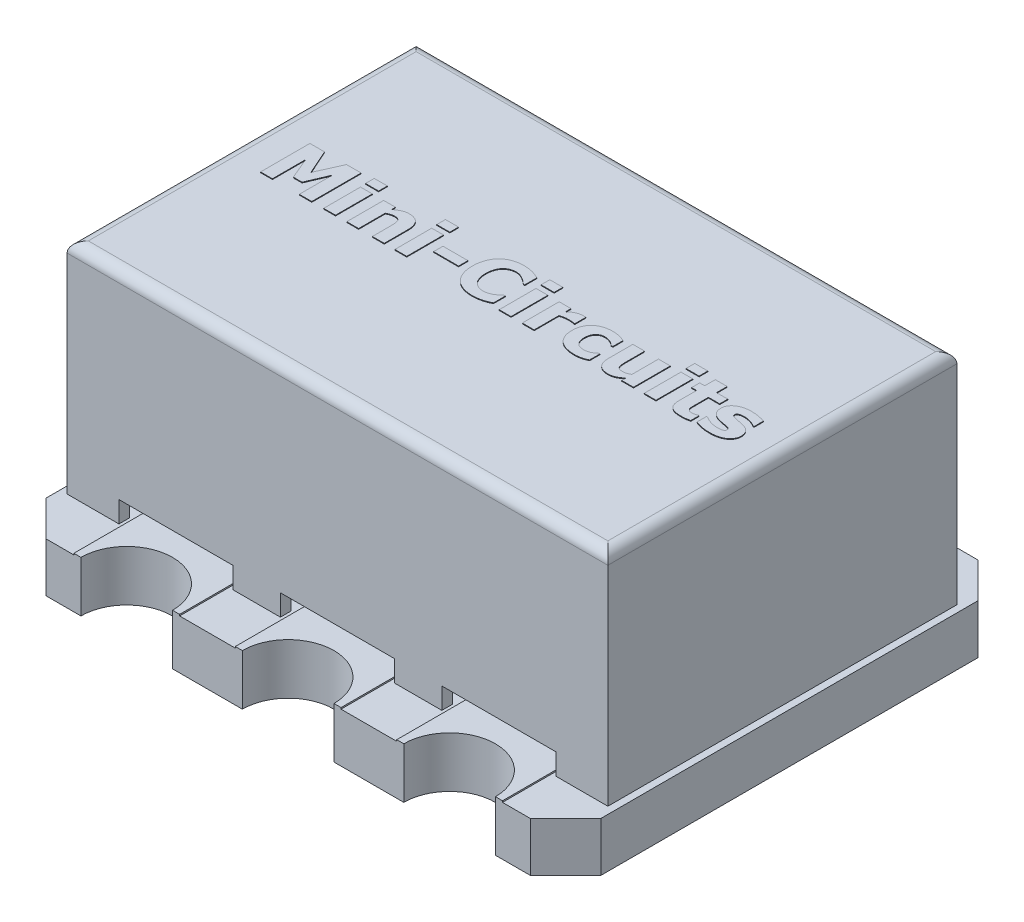
from build123d import *

# Parameters (mm, degrees)
BOSS_EXTRUDE1_DEPTH = 0.7
SKETCH2_W           = 7.67
SKETCH2_H           = 4.95
SKETCH2_W_2         = 7.37
SKETCH2_H_2         = 4.65
BOSS_EXTRUDE2_DEPTH = 3.11
SKETCH3_W           = 7.67
SKETCH3_H           = 4.95
BOSS_EXTRUDE3_DEPTH = 0.15
SKETCH4_W           = 1.62
SKETCH4_H           = 0.3
CUT_EXTRUDE1_DEPTH  = 8.869105731
FILLET1_R           = 0.15
BOSS_EXTRUDE4_DEPTH = 0.02
CHAMFER1_SIZE       = 0.5
WRAP1_OUTLINE_W     = 0.168354431
WRAP1_OUTLINE_H     = 0.522784811
WRAP1_OUTLINE_W_2   = 0.16835443
WRAP1_OUTLINE_W_3   = 0.186075949
WRAP1_OUTLINE_H_2   = 0.124050633
WRAP1_OUTLINE_W_4   = 0.18607595
WRAP1_OUTLINE_W_5   = 0.354430379
WRAP1_OUTLINE_H_3   = 0.132911393
WRAP1_DEPTH         = 0.01


# Read off the part's stored shape, not the designer's step: Wrap1
with BuildPart() as part:
    # Sketch1 → Boss-Extrude1 (new body)
    with BuildSketch(Plane(origin=(0, 0, 0), x_dir=(1, 0, 0), z_dir=(0, 1, 0))):
        with BuildLine():
            Line((-2.94, 3.175), (-3.935, 3.175))
            Line((-3.935, 3.175), (-3.935, -3.175))
            Line((-3.935, -3.175), (-2.94, -3.175))
            ThreePointArc((-2.94, -3.175), (-2.29, -2.525), (-1.64, -3.175))
            Line((-1.64, -3.175), (-0.65, -3.175))
            ThreePointArc((-0.65, -3.175), (0, -2.525), (0.65, -3.175))
            Line((0.65, -3.175), (1.64, -3.175))
            ThreePointArc((1.64, -3.175), (2.29, -2.525), (2.94, -3.175))
            Line((2.94, -3.175), (3.935, -3.175))
            Line((3.935, -3.175), (3.935, 3.175))
            Line((3.935, 3.175), (2.94, 3.175))
            ThreePointArc((2.94, 3.175), (2.29, 2.525), (1.64, 3.175))
            Line((1.64, 3.175), (0.65, 3.175))
            ThreePointArc((0.65, 3.175), (0, 2.525), (-0.65, 3.175))
            Line((-0.65, 3.175), (-1.64, 3.175))
            ThreePointArc((-1.64, 3.175), (-2.29, 2.525), (-2.94, 3.175))
        make_face()
    extrude(amount=BOSS_EXTRUDE1_DEPTH)

    # Sketch2 → Boss-Extrude2 (add)
    with BuildSketch(Plane(origin=(0, 0.7, 0), x_dir=(1, 0, 0), z_dir=(0, 1, 0))):
        Rectangle(SKETCH2_W, SKETCH2_H)
        Rectangle(SKETCH2_W_2, SKETCH2_H_2, mode=Mode.SUBTRACT)
    extrude(amount=BOSS_EXTRUDE2_DEPTH)

    # Sketch3 → Boss-Extrude3 (add)
    with BuildSketch(Plane(origin=(0, 3.81, 0), x_dir=(1, 0, 0), z_dir=(0, 1, 0))):
        Rectangle(SKETCH3_W, SKETCH3_H)
    extrude(amount=-BOSS_EXTRUDE3_DEPTH)

    # Sketch4 → Cut-Extrude1 (cut, through all)
    with BuildSketch(Plane.XY.offset(2.475)):
        with Locations((-2.29, 0.85)):
            Rectangle(SKETCH4_W, SKETCH4_H)
        with Locations((0, 0.85)):
            Rectangle(SKETCH4_W, SKETCH4_H)
        with Locations((2.29, 0.85)):
            Rectangle(SKETCH4_W, SKETCH4_H)
    extrude(amount=-CUT_EXTRUDE1_DEPTH, mode=Mode.SUBTRACT)

    # Fillet1
    fillet1_edges = [part.edges().sort_by_distance(p)[0] for p in [
        (-3.835, 3.81, 0),
        (0, 3.81, 2.475),
        (3.835, 3.81, 0),
        (0, 3.81, -2.475),
    ]]
    fillet(fillet1_edges, radius=FILLET1_R)

    # Sketch5 → Boss-Extrude4 (add)
    with BuildSketch(Plane(origin=(0, 0.7, 0), x_dir=(1, 0, 0), z_dir=(0, 1, 0))):
        with BuildLine():
            Line((-3.04, 3.175), (-3.04, -3.175))
            Line((-3.04, -3.175), (-2.94, -3.175))
            ThreePointArc((-2.94, -3.175), (-2.29, -2.525), (-1.64, -3.175))
            Line((-1.64, -3.175), (-1.54, -3.175))
            Line((-1.54, -3.175), (-1.54, 3.175))
            Line((-1.54, 3.175), (-1.64, 3.175))
            ThreePointArc((-1.64, 3.175), (-2.29, 2.525), (-2.94, 3.175))
            Line((-2.94, 3.175), (-3.04, 3.175))
        make_face()
        with BuildLine():
            Line((-0.65, 3.175), (-0.75, 3.175))
            Line((-0.75, 3.175), (-0.75, -3.175))
            Line((-0.75, -3.175), (-0.65, -3.175))
            ThreePointArc((-0.65, -3.175), (0, -2.525), (0.65, -3.175))
            Line((0.65, -3.175), (0.75, -3.175))
            Line((0.75, -3.175), (0.75, 3.175))
            Line((0.75, 3.175), (0.65, 3.175))
            ThreePointArc((0.65, 3.175), (0, 2.525), (-0.65, 3.175))
        make_face()
        with BuildLine():
            Line((1.54, 3.175), (1.54, -3.175))
            Line((1.54, -3.175), (1.64, -3.175))
            ThreePointArc((1.64, -3.175), (2.29, -2.525), (2.94, -3.175))
            Line((2.94, -3.175), (3.04, -3.175))
            Line((3.04, -3.175), (3.04, 3.175))
            Line((3.04, 3.175), (2.94, 3.175))
            ThreePointArc((2.94, 3.175), (2.29, 2.525), (1.64, 3.175))
            Line((1.64, 3.175), (1.54, 3.175))
        make_face()
    extrude(amount=BOSS_EXTRUDE4_DEPTH)

    # Chamfer1
    chamfer1_edges = [part.edges().sort_by_distance(p)[0] for p in [
        (-3.935, 0.35, 3.175),
        (-3.935, 0.35, -3.175),
        (3.935, 0.35, -3.175),
        (3.935, 0.35, 3.175),
    ]]
    chamfer(chamfer1_edges, length=CHAMFER1_SIZE)

    # Wrap1 outline → Wrap1 (add)
    with BuildSketch(Plane(origin=(0, 3.81, 0), x_dir=(1, 0, 0), z_dir=(0, 1, 0))):
        with BuildLine():
            add(Edge.make_bspline(
                [(-1.714556962, -0.002889473), (-1.714699231, 0.007823841), (-1.714982977, 0.029190727), (-1.717318036, 0.055488156), (-1.719653999, 0.07542269), (-1.72229176, 0.088275159), (-1.725303067, 0.09911351), (-1.728190187, 0.105313674), (-1.729509494, 0.108146919)],
                knots=[0, 0, 0, 0, 0.284872648, 0.568156771, 0.701834766, 0.818349265, 0.916992339, 1, 1, 1, 1], degree=3))
            Line((-1.714556962, -0.002889473), (-1.714556962, -0.265943271))
            Line((-1.714556962, -0.265943271), (-1.546202532, -0.265943271))
            Line((-1.546202532, -0.265943271), (-1.546202532, 0.076442014))
            add(Edge.make_bspline(
                [(-1.729232595, 0.274563059), (-1.722258695, 0.274385335), (-1.708644402, 0.274038388), (-1.688801077, 0.271870422), (-1.670101133, 0.268015771), (-1.652655209, 0.262430966), (-1.636256894, 0.255531674), (-1.621123197, 0.246911101), (-1.607179016, 0.236702025), (-1.594379031, 0.225075435), (-1.582967764, 0.211845728), (-1.573031363, 0.197031117), (-1.564831399, 0.180590017), (-1.557769576, 0.162760063), (-1.552629999, 0.143315669), (-1.548944842, 0.122380307), (-1.546491834, 0.099944031), (-1.546300895, 0.084432731), (-1.546202532, 0.076442014)],
                knots=[0, 0, 0, 0, 0.068027598, 0.132801972, 0.194426045, 0.253935589, 0.311211977, 0.367661586, 0.423395882, 0.479476329, 0.535968998, 0.593400846, 0.65299206, 0.714852443, 0.780154935, 0.848763899, 0.922090033, 1, 1, 1, 1], degree=3))
            add(Edge.make_bspline(
                [(-1.909493671, 0.20201559), (-1.902093009, 0.207660654), (-1.88768718, 0.218649107), (-1.865449913, 0.232882976), (-1.84395493, 0.245551971), (-1.822573278, 0.256136911), (-1.800701793, 0.264527111), (-1.777828377, 0.270236333), (-1.75391139, 0.274036971), (-1.73755468, 0.274385653), (-1.729232595, 0.274563059)],
                knots=[0, 0, 0, 0, 0.140758065, 0.273993942, 0.399134081, 0.518101627, 0.634549138, 0.752747963, 0.874201321, 1, 1, 1, 1], degree=3))
            Line((-1.909493671, 0.20201559), (-1.909493671, 0.25684154))
            Line((-1.909493671, 0.25684154), (-2.077848101, 0.25684154))
            Line((-2.077848101, 0.25684154), (-2.077848101, -0.265943271))
            Line((-2.077848101, -0.265943271), (-1.909493671, -0.265943271))
            Line((-1.909493671, -0.265943271), (-1.909493671, 0.109946761))
            add(Edge.make_bspline(
                [(-1.80911788, 0.141651666), (-1.817041108, 0.141255603), (-1.83321974, 0.140446873), (-1.853248777, 0.13545173), (-1.869536906, 0.129765651), (-1.882456253, 0.124345992), (-1.895871956, 0.117663616), (-1.904855925, 0.112574096), (-1.909493671, 0.109946761)],
                knots=[0, 0, 0, 0, 0.223069911, 0.455491904, 0.578023928, 0.709139627, 0.849850706, 1, 1, 1, 1], degree=3))
            add(Edge.make_bspline(
                [(-1.729509494, 0.108146919), (-1.731220493, 0.110933776), (-1.734575148, 0.116397802), (-1.741139855, 0.123481955), (-1.748816399, 0.129335452), (-1.757767464, 0.1339901), (-1.768160037, 0.137391388), (-1.780148757, 0.140098001), (-1.794050551, 0.141277922), (-1.803902129, 0.14152229), (-1.80911788, 0.141651666)],
                knots=[0, 0, 0, 0, 0.107518234, 0.210804643, 0.31600875, 0.42412717, 0.541431676, 0.67532446, 0.828106029, 1, 1, 1, 1], degree=3))
        make_face()
        with BuildLine():
            add(Edge.make_bspline(
                [(-0.543136867, -0.190903714), (-0.550767825, -0.182906354), (-0.566143722, -0.166792181), (-0.585786257, -0.13914485), (-0.602835267, -0.108818261), (-0.614776526, -0.081515483), (-0.622812381, -0.058329587), (-0.628037636, -0.040064708), (-0.632523654, -0.021130174), (-0.63601264, -0.001515741), (-0.639043447, 0.018734878), (-0.640842229, 0.039682606), (-0.642189997, 0.061287365), (-0.64233266, 0.075932078), (-0.642405063, 0.083364483)],
                knots=[0, 0, 0, 0, 0.110546357, 0.222743888, 0.338389091, 0.458388707, 0.520486429, 0.583949287, 0.648499339, 0.715196223, 0.783344706, 0.853408279, 0.925602568, 1, 1, 1, 1], degree=3))
            add(Edge.make_bspline(
                [(-0.28659019, -0.283664789), (-0.299292269, -0.283353898), (-0.324308154, -0.282741618), (-0.361111915, -0.278450813), (-0.396375521, -0.271036429), (-0.430111558, -0.261076176), (-0.46184072, -0.247911647), (-0.491407588, -0.23189156), (-0.518799408, -0.213127412), (-0.535037161, -0.198299943), (-0.543136867, -0.190903714)],
                knots=[0, 0, 0, 0, 0.136225063, 0.268286026, 0.39671569, 0.522303043, 0.645017192, 0.764394826, 0.882475572, 1, 1, 1, 1], degree=3))
            add(Edge.make_bspline(
                [(-0.140110759, -0.263174283), (-0.151113189, -0.266188201), (-0.172304041, -0.271993053), (-0.199182739, -0.277769909), (-0.221451132, -0.281106901), (-0.240705091, -0.282361162), (-0.262714346, -0.283636917), (-0.278326755, -0.283655143), (-0.28659019, -0.283664789)],
                knots=[0, 0, 0, 0, 0.23036849, 0.443693359, 0.554810457, 0.684770092, 0.833153096, 1, 1, 1, 1], degree=3))
            add(Edge.make_bspline(
                [(-0.039873418, -0.222747068), (-0.04841634, -0.226566433), (-0.065125693, -0.23403684), (-0.089726859, -0.245262717), (-0.114490641, -0.255335705), (-0.131482001, -0.26053428), (-0.140110759, -0.263174283)],
                knots=[0, 0, 0, 0, 0.259476127, 0.507516936, 0.749901271, 1, 1, 1, 1], degree=3))
            Line((-0.039873418, -0.222747068), (-0.039873418, -0.053285043))
            Line((-0.039873418, -0.053285043), (-0.058564082, -0.053285043))
            add(Edge.make_bspline(
                [(-0.133603639, -0.112126024), (-0.126145168, -0.107294928), (-0.111447768, -0.09777494), (-0.094383141, -0.084490826), (-0.081797819, -0.073852618), (-0.073207302, -0.066574115), (-0.065573762, -0.059756224), (-0.060820015, -0.05536767), (-0.058564082, -0.053285043)],
                knots=[0, 0, 0, 0, 0.279046371, 0.549878915, 0.678513651, 0.796762493, 0.903551864, 1, 1, 1, 1], degree=3))
            add(Edge.make_bspline(
                [(-0.257931171, -0.150753397), (-0.252479669, -0.150610313), (-0.241543353, -0.150323272), (-0.225208972, -0.14830069), (-0.208937091, -0.145174402), (-0.192922844, -0.14051913), (-0.177222731, -0.134927144), (-0.162111098, -0.128188752), (-0.147468119, -0.120787009), (-0.138224082, -0.115012363), (-0.133603639, -0.112126024)],
                knots=[0, 0, 0, 0, 0.123919129, 0.248595503, 0.373703788, 0.500242578, 0.627354259, 0.752317271, 0.87620086, 1, 1, 1, 1], degree=3))
            add(Edge.make_bspline(
                [(-0.391119462, -0.101465422), (-0.386320061, -0.105690923), (-0.376846659, -0.11403152), (-0.361142824, -0.124386413), (-0.344776158, -0.13310314), (-0.327555271, -0.139638482), (-0.310066645, -0.144598362), (-0.292544433, -0.147978152), (-0.275211747, -0.150392655), (-0.263661824, -0.150633766), (-0.257931171, -0.150753397)],
                knots=[0, 0, 0, 0, 0.13181231, 0.260180593, 0.387124392, 0.513753443, 0.639465987, 0.761800036, 0.881813824, 1, 1, 1, 1], degree=3))
            add(Edge.make_bspline(
                [(-0.456329114, 0.082810685), (-0.456169807, 0.071997937), (-0.455863823, 0.051229707), (-0.452075728, 0.021522844), (-0.446704605, -0.005579948), (-0.438365391, -0.029745549), (-0.428533134, -0.051312161), (-0.417412827, -0.070425135), (-0.405167672, -0.08726184), (-0.395716453, -0.096817589), (-0.391119462, -0.101465422)],
                knots=[0, 0, 0, 0, 0.16127913, 0.309771567, 0.446355257, 0.572913541, 0.690349552, 0.799629791, 0.902541663, 1, 1, 1, 1], degree=3))
            add(Edge.make_bspline(
                [(-0.394442247, 0.265840748), (-0.398942647, 0.260953043), (-0.408138893, 0.250965366), (-0.420075355, 0.23370113), (-0.430516182, 0.214177078), (-0.439888164, 0.192536109), (-0.447385539, 0.168479281), (-0.452502755, 0.142013731), (-0.455733424, 0.113210867), (-0.456125465, 0.093203636), (-0.456329114, 0.082810685)],
                knots=[0, 0, 0, 0, 0.100486144, 0.205336239, 0.316624156, 0.435234097, 0.561844987, 0.697210085, 0.842712832, 1, 1, 1, 1], degree=3))
            add(Edge.make_bspline(
                [(-0.258900316, 0.318866856), (-0.265135887, 0.318683846), (-0.277507029, 0.318320759), (-0.295875077, 0.316124367), (-0.313779586, 0.312172598), (-0.33127885, 0.306872466), (-0.348177515, 0.299581826), (-0.364461064, 0.290411109), (-0.380057133, 0.279152081), (-0.389592224, 0.27032874), (-0.394442247, 0.265840748)],
                knots=[0, 0, 0, 0, 0.125199765, 0.248391725, 0.370692055, 0.492894084, 0.614913344, 0.739370444, 0.867430816, 1, 1, 1, 1], degree=3))
            add(Edge.make_bspline(
                [(-0.138864715, 0.281485527), (-0.147723583, 0.286514142), (-0.165673932, 0.296703412), (-0.189707039, 0.306684387), (-0.209897948, 0.313013218), (-0.225721627, 0.316529369), (-0.242146914, 0.318434425), (-0.253265473, 0.318721412), (-0.258900316, 0.318866856)],
                knots=[0, 0, 0, 0, 0.239839301, 0.485976227, 0.611156554, 0.73804858, 0.86724402, 1, 1, 1, 1], degree=3))
            add(Edge.make_bspline(
                [(-0.060502373, 0.221398502), (-0.062849159, 0.223483122), (-0.067740841, 0.227828342), (-0.075614405, 0.234534541), (-0.084243231, 0.241838522), (-0.097324387, 0.25242004), (-0.115221256, 0.266276942), (-0.130798056, 0.276296672), (-0.138864715, 0.281485527)],
                knots=[0, 0, 0, 0, 0.095244834, 0.198530027, 0.313819432, 0.438262206, 0.709096368, 1, 1, 1, 1], degree=3))
            Line((-0.060502373, 0.221398502), (-0.039873418, 0.221398502))
            Line((-0.039873418, 0.221398502), (-0.039873418, 0.392937267))
            add(Edge.make_bspline(
                [(-0.141495253, 0.433779831), (-0.131476443, 0.430694019), (-0.112206909, 0.424758968), (-0.085384664, 0.413948707), (-0.061576019, 0.403318601), (-0.046782772, 0.396242324), (-0.039873418, 0.392937267)],
                knots=[0, 0, 0, 0, 0.286680941, 0.551383669, 0.790468623, 1, 1, 1, 1], degree=3))
            add(Edge.make_bspline(
                [(-0.286174842, 0.451778248), (-0.279020062, 0.45174304), (-0.265072658, 0.451674404), (-0.244669586, 0.450620554), (-0.225350935, 0.449218664), (-0.20146034, 0.446169613), (-0.173464419, 0.441756337), (-0.151893886, 0.436374355), (-0.141495253, 0.433779831)],
                knots=[0, 0, 0, 0, 0.146777353, 0.286125238, 0.419095851, 0.544057825, 0.780201286, 1, 1, 1, 1], degree=3))
            add(Edge.make_bspline(
                [(-0.545490506, 0.353340748), (-0.537629712, 0.360921562), (-0.521820404, 0.376167783), (-0.494733742, 0.395664227), (-0.465115068, 0.41266495), (-0.432844346, 0.426662325), (-0.398488443, 0.437840422), (-0.362458979, 0.446065039), (-0.324789348, 0.450784151), (-0.299202081, 0.451442873), (-0.286174842, 0.451778248)],
                knots=[0, 0, 0, 0, 0.114909661, 0.2311016, 0.35042709, 0.474070944, 0.600896219, 0.730500889, 0.862789974, 1, 1, 1, 1], degree=3))
            add(Edge.make_bspline(
                [(-0.642405063, 0.083364483), (-0.642137991, 0.097085377), (-0.64161478, 0.123965385), (-0.636773124, 0.163241394), (-0.629077325, 0.200548782), (-0.61828906, 0.235848833), (-0.604473575, 0.26897291), (-0.587769414, 0.299714315), (-0.568455423, 0.328195459), (-0.553131479, 0.344974314), (-0.545490506, 0.353340748)],
                knots=[0, 0, 0, 0, 0.139917816, 0.27410691, 0.403001204, 0.528090818, 0.650059438, 0.768450322, 0.884542466, 1, 1, 1, 1], degree=3))
        make_face()
        with BuildLine():
            add(Edge.make_bspline(
                [(0.778085443, 0.097347869), (0.776021143, 0.098082773), (0.771412548, 0.099723464), (0.763499151, 0.101378646), (0.753986415, 0.102924445), (0.743299966, 0.104029553), (0.732267042, 0.104978002), (0.721834686, 0.10566315), (0.712372143, 0.106116467), (0.70641526, 0.106179048), (0.703599684, 0.106208628)],
                knots=[0, 0, 0, 0, 0.087224477, 0.194730587, 0.321398094, 0.471261829, 0.622596227, 0.762651205, 0.887814869, 1, 1, 1, 1], degree=3))
            Line((0.778085443, 0.097347869), (0.793037975, 0.097347869))
            Line((0.793037975, 0.097347869), (0.793037975, 0.255041698))
            add(Edge.make_bspline(
                [(0.753164557, 0.25684154), (0.756349371, 0.25681355), (0.763090577, 0.256754305), (0.773334391, 0.256292923), (0.783447264, 0.255819279), (0.789993125, 0.255288564), (0.793037975, 0.255041698)],
                knots=[0, 0, 0, 0, 0.239309374, 0.506539313, 0.77046356, 1, 1, 1, 1], degree=3))
            add(Edge.make_bspline(
                [(0.580379747, 0.179725242), (0.584919482, 0.183591312), (0.593740106, 0.191103016), (0.607038967, 0.201433966), (0.619824387, 0.21083871), (0.632248461, 0.219006447), (0.644023075, 0.226542851), (0.655528065, 0.232665738), (0.666449918, 0.238060427), (0.680337664, 0.243447879), (0.697060799, 0.248584713), (0.716423352, 0.253504107), (0.735092495, 0.256156678), (0.747250476, 0.256617419), (0.753164557, 0.25684154)],
                knots=[0, 0, 0, 0, 0.092435416, 0.179600353, 0.261032412, 0.338425676, 0.410097306, 0.477650603, 0.540374375, 0.598835666, 0.708361082, 0.811442899, 0.908279025, 1, 1, 1, 1], degree=3))
            Line((0.580379747, 0.179725242), (0.580379747, 0.25684154))
            Line((0.580379747, 0.25684154), (0.412025316, 0.25684154))
            Line((0.412025316, 0.25684154), (0.412025316, -0.265943271))
            Line((0.412025316, -0.265943271), (0.580379747, -0.265943271))
            Line((0.580379747, -0.265943271), (0.580379747, 0.085579673))
            add(Edge.make_bspline(
                [(0.703599684, 0.106208628), (0.697737957, 0.106154938), (0.686377451, 0.106050881), (0.669880764, 0.105267473), (0.654457042, 0.103714903), (0.634865316, 0.1009349), (0.610064546, 0.095361186), (0.590573227, 0.088938552), (0.580379747, 0.085579673)],
                knots=[0, 0, 0, 0, 0.139991239, 0.271314476, 0.394253112, 0.510063494, 0.743775266, 1, 1, 1, 1], degree=3))
        make_face()
        with BuildLine():
            add(Edge.make_bspline(
                [(0.941871044, -0.216239948), (0.935209601, -0.210256117), (0.921912475, -0.198311595), (0.904639084, -0.17751779), (0.889812552, -0.154494979), (0.877126763, -0.129353408), (0.867103104, -0.101914211), (0.860155357, -0.07216495), (0.855762131, -0.040263643), (0.855300469, -0.018226212), (0.855063291, -0.006904505)],
                knots=[0, 0, 0, 0, 0.114542769, 0.228642609, 0.344856121, 0.464574641, 0.588522455, 0.717951557, 0.855097918, 1, 1, 1, 1], degree=3))
            add(Edge.make_bspline(
                [(1.164912975, -0.283664789), (1.153782158, -0.283512167), (1.13193415, -0.283212593), (1.099935136, -0.279873396), (1.069377575, -0.274852319), (1.04035821, -0.267696086), (1.012984408, -0.258312454), (0.987399759, -0.246622408), (0.963483056, -0.232852039), (0.949049617, -0.221757764), (0.941871044, -0.216239948)],
                knots=[0, 0, 0, 0, 0.140462675, 0.275705696, 0.405674832, 0.531147621, 0.652562158, 0.770400365, 0.885807008, 1, 1, 1, 1], degree=3))
            add(Edge.make_bspline(
                [(1.342405063, -0.242545327), (1.335787426, -0.245608123), (1.322550561, -0.251734449), (1.302147118, -0.259806503), (1.28119442, -0.266616659), (1.259835812, -0.272863083), (1.237648388, -0.27775045), (1.214426944, -0.281175058), (1.190057812, -0.283287231), (1.173408899, -0.28353722), (1.164912975, -0.283664789)],
                knots=[0, 0, 0, 0, 0.119003006, 0.238034614, 0.357845363, 0.478484315, 0.601114968, 0.72830586, 0.861354732, 1, 1, 1, 1], degree=3))
            Line((1.342405063, -0.242545327), (1.342405063, -0.09758884))
            Line((1.342405063, -0.09758884), (1.31900712, -0.09758884))
            add(Edge.make_bspline(
                [(1.269580696, -0.136077764), (1.27453919, -0.133083964), (1.284068803, -0.127330248), (1.296844633, -0.11738703), (1.308353509, -0.10754195), (1.315522245, -0.100844576), (1.31900712, -0.09758884)],
                knots=[0, 0, 0, 0, 0.276483243, 0.531366743, 0.772187384, 1, 1, 1, 1], degree=3))
            add(Edge.make_bspline(
                [(1.171973892, -0.159614157), (1.17705479, -0.159556593), (1.186959807, -0.159444374), (1.201368762, -0.157931908), (1.215046183, -0.155976623), (1.22788801, -0.152887686), (1.239817753, -0.149143498), (1.250777324, -0.145147713), (1.260665572, -0.140917755), (1.266694915, -0.137644445), (1.269580696, -0.136077764)],
                knots=[0, 0, 0, 0, 0.150109928, 0.292633611, 0.4278751, 0.558240399, 0.682503444, 0.797301157, 0.902983704, 1, 1, 1, 1], degree=3))
            add(Edge.make_bspline(
                [(1.032278481, -0.006904505), (1.032381902, -0.0129536), (1.032582844, -0.024706687), (1.034217444, -0.041797964), (1.037128681, -0.057767983), (1.041127417, -0.072645222), (1.046197854, -0.086407351), (1.052533673, -0.098989125), (1.059788169, -0.110586777), (1.068500075, -0.120825061), (1.078047261, -0.13003931), (1.088651502, -0.137992253), (1.100266177, -0.144629267), (1.11274144, -0.150260509), (1.126272726, -0.154309297), (1.140668481, -0.157366139), (1.155995367, -0.159386035), (1.166567844, -0.159536976), (1.171973892, -0.159614157)],
                knots=[0, 0, 0, 0, 0.076896037, 0.149405131, 0.217993584, 0.283037434, 0.345046743, 0.404084223, 0.461863406, 0.518505364, 0.574527063, 0.630265387, 0.686520102, 0.744305242, 0.803876747, 0.865671956, 0.931313748, 1, 1, 1, 1], degree=3))
            add(Edge.make_bspline(
                [(1.169204905, 0.150512426), (1.163846065, 0.15037551), (1.153460883, 0.150110173), (1.138329665, 0.14817172), (1.124203133, 0.144820573), (1.110872274, 0.140351693), (1.09870105, 0.134078016), (1.087203341, 0.126992142), (1.076882012, 0.118210588), (1.067488383, 0.108286403), (1.059175995, 0.09715281), (1.051988729, 0.085067397), (1.045809643, 0.072062146), (1.040896389, 0.058076792), (1.036993819, 0.043167755), (1.034266863, 0.027328085), (1.032574411, 0.0105309), (1.032378814, -0.000993169), (1.032278481, -0.006904505)],
                knots=[0, 0, 0, 0, 0.06794339, 0.131671128, 0.192989036, 0.251839194, 0.309412854, 0.366232163, 0.422725095, 0.480678157, 0.539195711, 0.59850665, 0.658711516, 0.721456415, 0.786178522, 0.853907376, 0.925060967, 1, 1, 1, 1], degree=3))
            add(Edge.make_bspline(
                [(1.262658228, 0.127945179), (1.256164612, 0.131045258), (1.242815411, 0.137418223), (1.224895569, 0.143155026), (1.209572352, 0.147204785), (1.196889169, 0.148974453), (1.183355228, 0.150306889), (1.174008334, 0.150442655), (1.169204905, 0.150512426)],
                knots=[0, 0, 0, 0, 0.22209447, 0.456569009, 0.580031803, 0.711316299, 0.851643595, 1, 1, 1, 1], degree=3))
            add(Edge.make_bspline(
                [(1.31900712, 0.088487109), (1.31551574, 0.091414698), (1.307942192, 0.097765264), (1.295332726, 0.107572355), (1.280398152, 0.118426314), (1.268839697, 0.124628335), (1.262658228, 0.127945179)],
                knots=[0, 0, 0, 0, 0.198219554, 0.429980516, 0.695153217, 1, 1, 1, 1], degree=3))
            Line((1.31900712, 0.088487109), (1.342405063, 0.088487109))
            Line((1.342405063, 0.088487109), (1.342405063, 0.232336002))
            add(Edge.make_bspline(
                [(1.159790348, 0.274563059), (1.168517435, 0.274444313), (1.185677844, 0.274210819), (1.210884378, 0.271952219), (1.235024472, 0.268241065), (1.258105656, 0.263035907), (1.280317691, 0.256786317), (1.301733998, 0.249567353), (1.322487709, 0.241601764), (1.335792454, 0.235412257), (1.342405063, 0.232336002)],
                knots=[0, 0, 0, 0, 0.13845898, 0.272257272, 0.401207844, 0.525757946, 0.647476993, 0.767205829, 0.884298659, 1, 1, 1, 1], degree=3))
            add(Edge.make_bspline(
                [(0.947547468, 0.209907204), (0.954727957, 0.215288656), (0.969175662, 0.226116558), (0.99297244, 0.239380246), (1.018257928, 0.250611863), (1.045075745, 0.259333068), (1.072939373, 0.265972826), (1.101398156, 0.27106163), (1.130422728, 0.274001803), (1.149954023, 0.274375073), (1.159790348, 0.274563059)],
                knots=[0, 0, 0, 0, 0.119012231, 0.239461918, 0.360705236, 0.485865228, 0.613214929, 0.740735475, 0.869429541, 1, 1, 1, 1], degree=3))
            add(Edge.make_bspline(
                [(0.855063291, -0.006904505), (0.855334614, 0.005018085), (0.855860474, 0.028125646), (0.860506791, 0.061530958), (0.867994077, 0.092454723), (0.878756984, 0.12081808), (0.892270078, 0.146670421), (0.908121527, 0.170273264), (0.926465208, 0.191573734), (0.940515176, 0.203791811), (0.947547468, 0.209907204)],
                knots=[0, 0, 0, 0, 0.146474689, 0.283887385, 0.413616279, 0.536766185, 0.655753186, 0.771383206, 0.885572686, 1, 1, 1, 1], degree=3))
        make_face()
        with BuildLine():
            add(Edge.make_bspline(
                [(1.820886076, -0.211117321), (1.813233289, -0.216777992), (1.798478829, -0.227691682), (1.776262652, -0.242243032), (1.755061605, -0.254725165), (1.734610397, -0.265520234), (1.713502912, -0.273856165), (1.690910391, -0.279609158), (1.666394545, -0.283116996), (1.649405724, -0.283478134), (1.640625, -0.283664789)],
                knots=[0, 0, 0, 0, 0.143863335, 0.277366403, 0.401194655, 0.515695657, 0.626584503, 0.743330899, 0.867339796, 1, 1, 1, 1], degree=3))
            Line((1.820886076, -0.211117321), (1.820886076, -0.265943271))
            Line((1.820886076, -0.265943271), (1.989240506, -0.265943271))
            Line((1.989240506, -0.265943271), (1.989240506, 0.25684154))
            Line((1.989240506, 0.25684154), (1.820886076, 0.25684154))
            Line((1.820886076, 0.25684154), (1.820886076, -0.119048492))
            add(Edge.make_bspline(
                [(1.720094937, -0.150753397), (1.72388379, -0.150631196), (1.731673933, -0.150379941), (1.743610416, -0.148770441), (1.756133617, -0.146238847), (1.773732994, -0.141625682), (1.79596601, -0.133371434), (1.812514984, -0.123859822), (1.820886076, -0.119048492)],
                knots=[0, 0, 0, 0, 0.106360787, 0.218685126, 0.337593044, 0.464859882, 0.729306056, 1, 1, 1, 1], degree=3))
            add(Edge.make_bspline(
                [(1.640901899, -0.11724865), (1.642512178, -0.120039185), (1.645677848, -0.125525135), (1.652116524, -0.13257517), (1.659648406, -0.138433515), (1.668535877, -0.143142023), (1.678987445, -0.146527947), (1.691111448, -0.148955177), (1.705013557, -0.150451941), (1.71487599, -0.150649078), (1.720094937, -0.150753397)],
                knots=[0, 0, 0, 0, 0.106132161, 0.208646693, 0.312902215, 0.419938665, 0.538974206, 0.674367511, 0.827683643, 1, 1, 1, 1], degree=3))
            add(Edge.make_bspline(
                [(1.625949367, -0.006212258), (1.625960816, -0.012627555), (1.62598273, -0.024907064), (1.626559102, -0.04244771), (1.627405406, -0.058324918), (1.628376339, -0.072619118), (1.630147456, -0.085546373), (1.632791416, -0.097209501), (1.636087198, -0.107846714), (1.63933743, -0.114193625), (1.640901899, -0.11724865)],
                knots=[0, 0, 0, 0, 0.170175213, 0.325732116, 0.465489833, 0.591967404, 0.705717333, 0.811152236, 0.909099921, 1, 1, 1, 1], degree=3))
            Line((1.625949367, -0.006212258), (1.625949367, 0.25684154))
            Line((1.625949367, 0.25684154), (1.457594937, 0.25684154))
            Line((1.457594937, 0.25684154), (1.457594937, -0.085543745))
            add(Edge.make_bspline(
                [(1.640625, -0.283664789), (1.633510583, -0.283505686), (1.619656758, -0.283195865), (1.59951545, -0.280782701), (1.580564269, -0.277015677), (1.562951222, -0.271374685), (1.546393802, -0.264555868), (1.531333173, -0.255742257), (1.517419353, -0.245526898), (1.504795708, -0.23378835), (1.493661373, -0.220341615), (1.483952017, -0.20548236), (1.475721334, -0.189139888), (1.469129867, -0.171280322), (1.463845335, -0.151971211), (1.460177492, -0.131116765), (1.457933434, -0.108806789), (1.457709847, -0.093440889), (1.457594937, -0.085543745)],
                knots=[0, 0, 0, 0, 0.069308487, 0.134963639, 0.197407514, 0.257287053, 0.314920659, 0.371538195, 0.426854835, 0.482854601, 0.539052649, 0.596554513, 0.655482483, 0.716960201, 0.781764273, 0.850305454, 0.923066053, 1, 1, 1, 1], degree=3))
        make_face()
        with BuildLine():
            add(Edge.make_bspline(
                [(2.671795886, -0.283664789), (2.663808934, -0.283515012), (2.648367959, -0.283225452), (2.625973395, -0.281484881), (2.605190781, -0.2783424), (2.585969137, -0.273840569), (2.568213625, -0.268497148), (2.552149818, -0.261472311), (2.537640815, -0.253300961), (2.524588849, -0.243828436), (2.51301875, -0.232813375), (2.503343725, -0.21983682), (2.494892937, -0.205299903), (2.488216927, -0.188868481), (2.482909087, -0.170686043), (2.479340364, -0.150725315), (2.476854854, -0.129032973), (2.476675367, -0.113979809), (2.476582278, -0.106172701)],
                knots=[0, 0, 0, 0, 0.078400398, 0.151569529, 0.220312516, 0.284484121, 0.345232403, 0.402037353, 0.456201676, 0.508390247, 0.559969745, 0.612336914, 0.666726185, 0.72460471, 0.785958003, 0.852325632, 0.923410797, 1, 1, 1, 1], degree=3))
            add(Edge.make_bspline(
                [(2.80443038, -0.268435359), (2.795086843, -0.27067674), (2.775965078, -0.275263777), (2.75116011, -0.279218216), (2.729884858, -0.281619143), (2.712008581, -0.282837668), (2.69247587, -0.283480057), (2.678857274, -0.283601711), (2.671795886, -0.283664789)],
                knots=[0, 0, 0, 0, 0.215224479, 0.440461871, 0.562184874, 0.694864197, 0.841783813, 1, 1, 1, 1], degree=3))
            Line((2.80443038, -0.268435359), (2.80443038, -0.150753397))
            Line((2.80443038, -0.150753397), (2.790170095, -0.150753397))
            add(Edge.make_bspline(
                [(2.725375791, -0.168474916), (2.727778537, -0.168373353), (2.732927856, -0.168155695), (2.741124126, -0.166991041), (2.750316336, -0.16500533), (2.760077678, -0.162301891), (2.769598662, -0.159421762), (2.777987653, -0.156541209), (2.784713969, -0.153741158), (2.788521537, -0.151656143), (2.790170095, -0.150753397)],
                knots=[0, 0, 0, 0, 0.106598778, 0.22845156, 0.366530822, 0.523411054, 0.677489628, 0.807587968, 0.91669164, 1, 1, 1, 1], degree=3))
            add(Edge.make_bspline(
                [(2.652966772, -0.132478081), (2.654213931, -0.135160638), (2.656674085, -0.140452271), (2.662016655, -0.147552816), (2.668539939, -0.153802992), (2.676515724, -0.15917322), (2.686093257, -0.163588081), (2.697625973, -0.166222357), (2.710855397, -0.16831831), (2.720334653, -0.168420546), (2.725375791, -0.168474916)],
                knots=[0, 0, 0, 0, 0.102591238, 0.202372268, 0.30675389, 0.41531677, 0.535200489, 0.670987026, 0.825028487, 1, 1, 1, 1], degree=3))
            add(Edge.make_bspline(
                [(2.644936709, -0.046501024), (2.645002998, -0.055179854), (2.645127117, -0.071430035), (2.645003822, -0.094237407), (2.646667895, -0.114627744), (2.650918764, -0.126674248), (2.652966772, -0.132478081)],
                knots=[0, 0, 0, 0, 0.299478537, 0.560741501, 0.788371543, 1, 1, 1, 1], degree=3))
            Line((2.644936709, -0.046501024), (2.644936709, 0.141651666))
            Line((2.644936709, 0.141651666), (2.80443038, 0.141651666))
            Line((2.80443038, 0.141651666), (2.80443038, 0.25684154))
            Line((2.80443038, 0.25684154), (2.644936709, 0.25684154))
            Line((2.644936709, 0.25684154), (2.644936709, 0.407474451))
            Line((2.644936709, 0.407474451), (2.476582278, 0.407474451))
            Line((2.476582278, 0.407474451), (2.476582278, 0.25684154))
            Line((2.476582278, 0.25684154), (2.405696203, 0.25684154))
            Line((2.405696203, 0.25684154), (2.405696203, 0.141651666))
            Line((2.405696203, 0.141651666), (2.476582278, 0.141651666))
            Line((2.476582278, 0.141651666), (2.476582278, -0.106172701))
        make_face()
        with BuildLine():
            add(Edge.make_bspline(
                [(3.083405854, -0.283664789), (3.072095071, -0.283499835), (3.04995611, -0.283176964), (3.017553085, -0.280816268), (2.986749209, -0.2768806), (2.957861548, -0.271159132), (2.931217667, -0.264512824), (2.907105467, -0.257615752), (2.885661315, -0.250597485), (2.872607092, -0.24503026), (2.866455696, -0.242406878)],
                knots=[0, 0, 0, 0, 0.152615475, 0.29871918, 0.438140595, 0.571383757, 0.69583703, 0.808577611, 0.909798163, 1, 1, 1, 1], degree=3))
            add(Edge.make_bspline(
                [(3.353797468, -0.101326973), (3.353602827, -0.10798841), (3.353218909, -0.121127646), (3.349637439, -0.140289028), (3.343954805, -0.158485535), (3.335968808, -0.175641424), (3.325831474, -0.19186458), (3.313124758, -0.206854413), (3.298428302, -0.221090651), (3.281325258, -0.233981379), (3.262457317, -0.245743254), (3.241718843, -0.25584174), (3.219498122, -0.26462437), (3.195432219, -0.271428059), (3.169835052, -0.277031895), (3.14247453, -0.280785125), (3.113492687, -0.283194582), (3.093610055, -0.283505315), (3.083405854, -0.283664789)],
                knots=[0, 0, 0, 0, 0.05477095, 0.108032003, 0.159799021, 0.211282482, 0.263332898, 0.31672242, 0.372588376, 0.4313789, 0.492607617, 0.555278578, 0.620935658, 0.688959767, 0.76084037, 0.83640661, 0.9160403, 1, 1, 1, 1], degree=3))
            add(Edge.make_bspline(
                [(3.226700949, 0.046952299), (3.231933541, 0.045439277), (3.242159332, 0.042482455), (3.256816968, 0.037219126), (3.270487357, 0.031410604), (3.283102943, 0.024931561), (3.294653257, 0.017729307), (3.305058562, 0.009823429), (3.31438928, 0.001317683), (3.322783792, -0.007717594), (3.33009234, -0.017378077), (3.336396013, -0.027647632), (3.341824916, -0.038464255), (3.346252481, -0.049911888), (3.349535635, -0.061993768), (3.352097029, -0.074559657), (3.353413446, -0.087777486), (3.353667911, -0.096755792), (3.353797468, -0.101326973)],
                knots=[0, 0, 0, 0, 0.076763803, 0.150015638, 0.219374332, 0.286000775, 0.349714955, 0.410994932, 0.469937691, 0.527481824, 0.584597839, 0.640383257, 0.697112696, 0.754979496, 0.813061625, 0.873405655, 0.935546237, 1, 1, 1, 1], degree=3))
            add(Edge.make_bspline(
                [(3.114141614, 0.069657995), (3.122859436, 0.067925873), (3.140873272, 0.064346748), (3.16869703, 0.059320865), (3.197654192, 0.054189884), (3.216987561, 0.049372586), (3.226700949, 0.046952299)],
                knots=[0, 0, 0, 0, 0.232159295, 0.479716122, 0.738601199, 1, 1, 1, 1], degree=3))
            add(Edge.make_bspline(
                [(3.043670886, 0.118115274), (3.043839462, 0.11514931), (3.044160774, 0.109496062), (3.046343893, 0.101474859), (3.050360286, 0.094668384), (3.056209531, 0.088557547), (3.065386364, 0.08373563), (3.077897027, 0.078825495), (3.094655048, 0.074169993), (3.107207689, 0.071263504), (3.114141614, 0.069657995)],
                knots=[0, 0, 0, 0, 0.094584327, 0.180281588, 0.262048513, 0.344251179, 0.446459835, 0.589089717, 0.773018219, 1, 1, 1, 1], degree=3))
            add(Edge.make_bspline(
                [(3.13684731, 0.159373185), (3.130567387, 0.159230102), (3.118437446, 0.15895373), (3.10097941, 0.157137812), (3.08509669, 0.153603844), (3.070983904, 0.149116769), (3.059195742, 0.143424844), (3.050317625, 0.136368208), (3.044616559, 0.127725545), (3.043982411, 0.121281101), (3.043670886, 0.118115274)],
                knots=[0, 0, 0, 0, 0.170123311, 0.328600431, 0.474493986, 0.610083959, 0.729161813, 0.826794789, 0.914913088, 1, 1, 1, 1], degree=3))
            add(Edge.make_bspline(
                [(3.313231804, 0.106208628), (3.307007855, 0.110039425), (3.294436003, 0.117777313), (3.274298484, 0.127841351), (3.253030755, 0.137027697), (3.230565908, 0.144791448), (3.207544662, 0.151369685), (3.184104755, 0.15590602), (3.160548, 0.158786032), (3.14474709, 0.159177479), (3.13684731, 0.159373185)],
                knots=[0, 0, 0, 0, 0.117433761, 0.237206311, 0.361504589, 0.489610063, 0.61902989, 0.74604593, 0.873033801, 1, 1, 1, 1], degree=3))
            Line((3.313231804, 0.106208628), (3.32721519, 0.106208628))
            Line((3.32721519, 0.106208628), (3.32721519, 0.237597078))
            add(Edge.make_bspline(
                [(3.131863133, 0.274563059), (3.141466596, 0.274442098), (3.160515038, 0.274202174), (3.188802955, 0.271915423), (3.21648459, 0.268200272), (3.243155697, 0.263070782), (3.268083541, 0.257231664), (3.290471561, 0.251011699), (3.310016443, 0.24481667), (3.321752568, 0.239890146), (3.32721519, 0.237597078)],
                knots=[0, 0, 0, 0, 0.144008395, 0.28564023, 0.425325595, 0.562702609, 0.692815406, 0.809188949, 0.911186313, 1, 1, 1, 1], degree=3))
            add(Edge.make_bspline(
                [(2.866455696, 0.096932521), (2.866661214, 0.103177896), (2.867066137, 0.115482849), (2.870499071, 0.133498739), (2.876086719, 0.150707258), (2.883857016, 0.167117715), (2.893994772, 0.182686262), (2.90645561, 0.197319047), (2.920865283, 0.211402975), (2.937563763, 0.224314699), (2.956031412, 0.236297993), (2.976461236, 0.246397438), (2.998376035, 0.255232858), (3.021915605, 0.262366227), (3.047140492, 0.267929766), (3.073947333, 0.271668429), (3.102374944, 0.274100137), (3.121843328, 0.274405762), (3.131863133, 0.274563059)],
                knots=[0, 0, 0, 0, 0.052653383, 0.103740341, 0.154098087, 0.204951583, 0.256464051, 0.310352422, 0.366796276, 0.426145082, 0.488137334, 0.552213382, 0.618077812, 0.687293147, 0.759464392, 0.835779405, 0.915480488, 1, 1, 1, 1], degree=3))
            add(Edge.make_bspline(
                [(3.004074367, -0.060899758), (2.998422445, -0.059307527), (2.987387507, -0.056198821), (2.971581036, -0.050484788), (2.956850549, -0.044150216), (2.943287044, -0.03705144), (2.930742991, -0.029513131), (2.919454915, -0.021089904), (2.909210643, -0.012164578), (2.900107986, -0.002528946), (2.892187042, 0.007803901), (2.885253049, 0.018724213), (2.879405525, 0.030268453), (2.874692943, 0.042433297), (2.870939243, 0.055160017), (2.868309788, 0.068552449), (2.866799701, 0.082545015), (2.866571644, 0.092083167), (2.866455696, 0.096932521)],
                knots=[0, 0, 0, 0, 0.077199492, 0.150725981, 0.220855094, 0.287904367, 0.3519184, 0.413096137, 0.472873044, 0.5304049, 0.587095089, 0.643837233, 0.700293029, 0.756983217, 0.815173948, 0.874567586, 0.936228095, 1, 1, 1, 1], degree=3))
            add(Edge.make_bspline(
                [(3.11068038, -0.082082511), (3.107362561, -0.081320037), (3.100198194, -0.07967358), (3.088580941, -0.077570337), (3.075360819, -0.075111846), (3.055930977, -0.072259084), (3.031859223, -0.067921378), (3.013051228, -0.063168336), (3.004074367, -0.060899758)],
                knots=[0, 0, 0, 0, 0.093913825, 0.202793841, 0.325678649, 0.464888043, 0.744596592, 1, 1, 1, 1], degree=3))
            add(Edge.make_bspline(
                [(3.176582278, -0.126801657), (3.176462069, -0.12377682), (3.176234702, -0.11805555), (3.173467963, -0.110154251), (3.169106258, -0.103533794), (3.162571043, -0.098220264), (3.153622103, -0.094039087), (3.142094799, -0.089780209), (3.127451747, -0.08568754), (3.116602368, -0.08335545), (3.11068038, -0.082082511)],
                knots=[0, 0, 0, 0, 0.10320569, 0.195206437, 0.282908867, 0.371575088, 0.479759224, 0.619841344, 0.792495513, 1, 1, 1, 1], degree=3))
            add(Edge.make_bspline(
                [(3.08215981, -0.168474916), (3.089639817, -0.168344643), (3.103613177, -0.16810128), (3.123044002, -0.166295057), (3.13940238, -0.163046932), (3.152846764, -0.158619917), (3.16336807, -0.152722377), (3.17103879, -0.145419726), (3.175910693, -0.136584622), (3.176356472, -0.13009097), (3.176582278, -0.126801657)],
                knots=[0, 0, 0, 0, 0.197463309, 0.3688801, 0.514392676, 0.636918071, 0.741190252, 0.829927781, 0.913851119, 1, 1, 1, 1], degree=3))
            add(Edge.make_bspline(
                [(2.955478639, -0.144661625), (2.964480866, -0.147844877), (2.983364652, -0.15452232), (3.008244269, -0.160743263), (3.029604492, -0.164817313), (3.046636983, -0.166776937), (3.064180331, -0.168295065), (3.076110618, -0.168414405), (3.08215981, -0.168474916)],
                knots=[0, 0, 0, 0, 0.220909738, 0.463397841, 0.59266249, 0.723958928, 0.860034748, 1, 1, 1, 1], degree=3))
            add(Edge.make_bspline(
                [(2.881408228, -0.1064496), (2.885832843, -0.109272919), (2.895214376, -0.115259216), (2.907569267, -0.122933868), (2.919198794, -0.129162985), (2.929776344, -0.134343919), (2.942058518, -0.139515215), (2.950853546, -0.142887973), (2.955478639, -0.144661625)],
                knots=[0, 0, 0, 0, 0.188429328, 0.399527564, 0.521828551, 0.661862336, 0.822181559, 1, 1, 1, 1], degree=3))
            Line((2.881408228, -0.1064496), (2.866455696, -0.1064496))
            Line((2.866455696, -0.1064496), (2.866455696, -0.242406878))
        make_face()
        Polygon((-2.751265823, 0.204369229), (-2.751265823, -0.265943271), (-2.574050633, -0.265943271), (-2.574050633, 0.434056729), (-2.781170886, 0.434056729), (-2.936926424, 0.085441223), (-3.09309731, 0.434056729), (-3.300632911, 0.434056729), (-3.300632911, -0.265943271), (-3.132278481, -0.265943271), (-3.132278481, 0.204369229), (-3.00352057, -0.09758884), (-2.880023734, -0.09758884), align=None)
        with Locations((-2.321518988, -0.004550866)):
            Rectangle(WRAP1_OUTLINE_W, WRAP1_OUTLINE_H)
        with Locations((-1.311392405, -0.004550866)):
            Rectangle(WRAP1_OUTLINE_W_2, WRAP1_OUTLINE_H)
        with Locations((0.16835443, -0.004550866)):
            Rectangle(WRAP1_OUTLINE_W, WRAP1_OUTLINE_H)
        with Locations((2.224050633, -0.004550866)):
            Rectangle(WRAP1_OUTLINE_W_2, WRAP1_OUTLINE_H)
        with Locations((-2.321518988, 0.398613692)):
            Rectangle(WRAP1_OUTLINE_W_3, WRAP1_OUTLINE_H_2)
        with Locations((-1.311392405, 0.398613692)):
            Rectangle(WRAP1_OUTLINE_W_4, WRAP1_OUTLINE_H_2)
        with Locations((0.16835443, 0.398613692)):
            Rectangle(WRAP1_OUTLINE_W_3, WRAP1_OUTLINE_H_2)
        with Locations((2.224050633, 0.398613692)):
            Rectangle(WRAP1_OUTLINE_W_4, WRAP1_OUTLINE_H_2)
        with Locations((-0.917088607, 0.048613692)):
            Rectangle(WRAP1_OUTLINE_W_5, WRAP1_OUTLINE_H_3)
    extrude(amount=WRAP1_DEPTH)


solid = part.part
